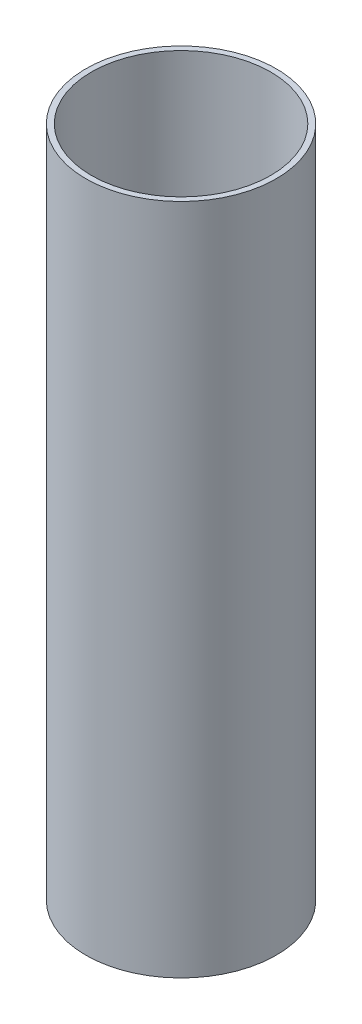
from build123d import *

# Parameters (mm, degrees)
SKETCH1_R           = 107.95
SKETCH1_R_2         = 101.6
BOSS_EXTRUDE1_DEPTH = 762


with BuildPart() as part:
    # Sketch1 → Boss-Extrude1 (new body)
    with BuildSketch(Plane(origin=(0, 0, 0), x_dir=(1, 0, 0), z_dir=(0, 1, 0))):
        Circle(SKETCH1_R)
        Circle(SKETCH1_R_2, mode=Mode.SUBTRACT)
    extrude(amount=BOSS_EXTRUDE1_DEPTH)


solid = part.part
